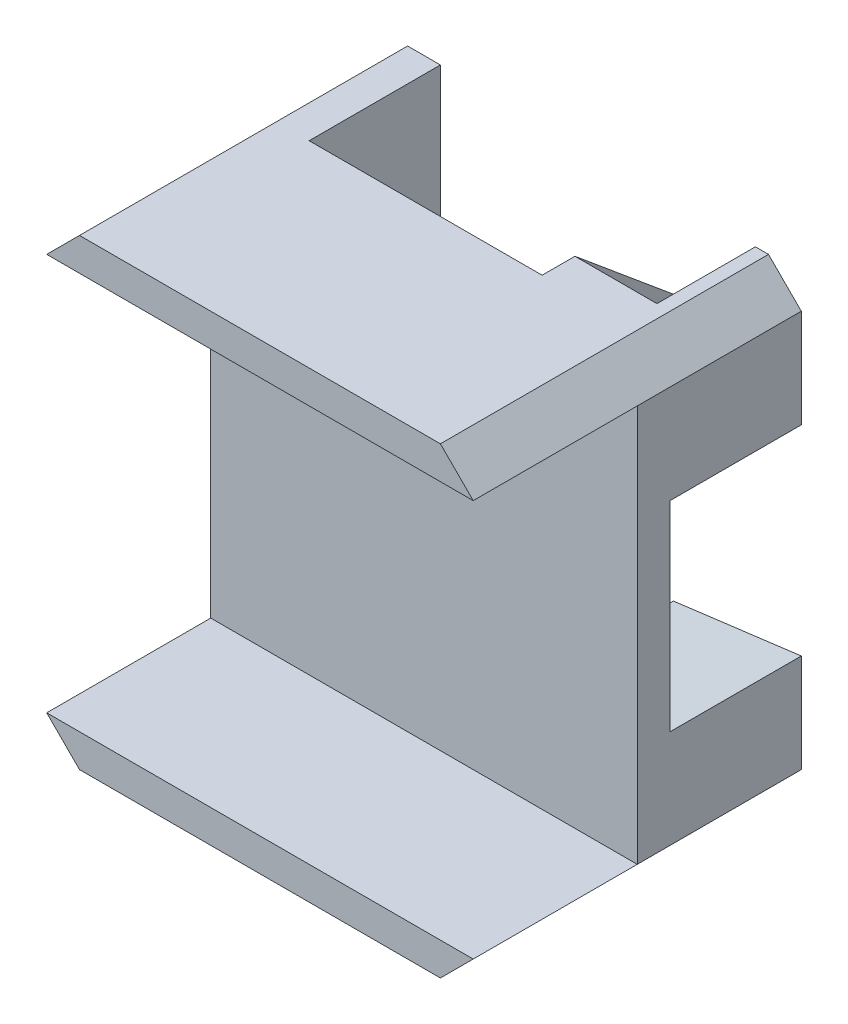
from build123d import *

# Parameters (mm, degrees)
SKETCH1_W             = 13
SKETCH1_H             = 1
BOSS_EXTRUDE1_DEPTH   = 6
BOSS_EXTRUDE1_2_DEPTH = 6
SKETCH1_3_W           = 13
SKETCH1_3_H           = 12.1
BOSS_EXTRUDE2_DEPTH   = 1
SKETCH2_W             = 2
SKETCH2_H             = 14.1
BOSS_EXTRUDE3_DEPTH   = 4
CHAMFER1_SIZE         = 1
CUT_EXTRUDE1_DEPTH    = 2.5


with BuildPart() as part:
    # Sketch1 → Boss-Extrude1 (new body)
    with BuildSketch(Plane.XY):
        with Locations((0, 6.55)):
            Rectangle(SKETCH1_W, SKETCH1_H)
    extrude(amount=BOSS_EXTRUDE1_DEPTH)



with BuildPart() as body_2:
    # Sketch1 → Boss-Extrude1 2 (new body)
    with BuildSketch(Plane.XY):
        with Locations((0, -6.55)):
            Rectangle(SKETCH1_W, SKETCH1_H)
    extrude(amount=BOSS_EXTRUDE1_2_DEPTH)


with BuildPart() as part_1:
    add(part.part)

    add(body_2.part)  # Boss-Extrude2 merges body 2
    # Sketch1<3> → Boss-Extrude2 (add)
    with BuildSketch(Plane.XY):
        Rectangle(SKETCH1_3_W, SKETCH1_3_H)
    extrude(amount=BOSS_EXTRUDE2_DEPTH)

    # Sketch2 → Boss-Extrude3 (add)
    with BuildSketch(Plane(origin=(0, 0, 0), x_dir=(-1, 0, 0), z_dir=(0, 0, -1))):
        with Locations((5.5, 0)):
            Rectangle(SKETCH2_W, SKETCH2_H)
        Polygon((-6.5, -3.05), (-2.6, -3.55), (-2.6, -7.05), (-6.5, -7.05), align=None)
        Polygon((-6.5, 7.05), (-2.6, 7.05), (-2.6, 3.55), (-6.5, 3.05), align=None)
    extrude(amount=BOSS_EXTRUDE3_DEPTH)

    # Chamfer1
    chamfer1_edges = [part_1.edges().sort_by_distance(p)[0] for p in [
        (-6.5, -7.05, 1),
        (6.5, -7.05, 1),
        (-6.5, 7.05, 1),
        (6.5, 7.05, 1),
    ]]
    chamfer(chamfer1_edges, length=CHAMFER1_SIZE - 0.0001)  # a hair under: the kernel refuses the full size

    # Sketch3 → Cut-Extrude1 (cut)
    with BuildSketch(Plane.ZY.offset(-2.6)):
        Polygon((-1, -7.05), (-4, -4.55), (-4, -7.05), align=None)
        Polygon((-1, 7.05), (-4, 4.55), (-4, 7.05), align=None)
    extrude(amount=-CUT_EXTRUDE1_DEPTH, mode=Mode.SUBTRACT)


solid = part_1.part
